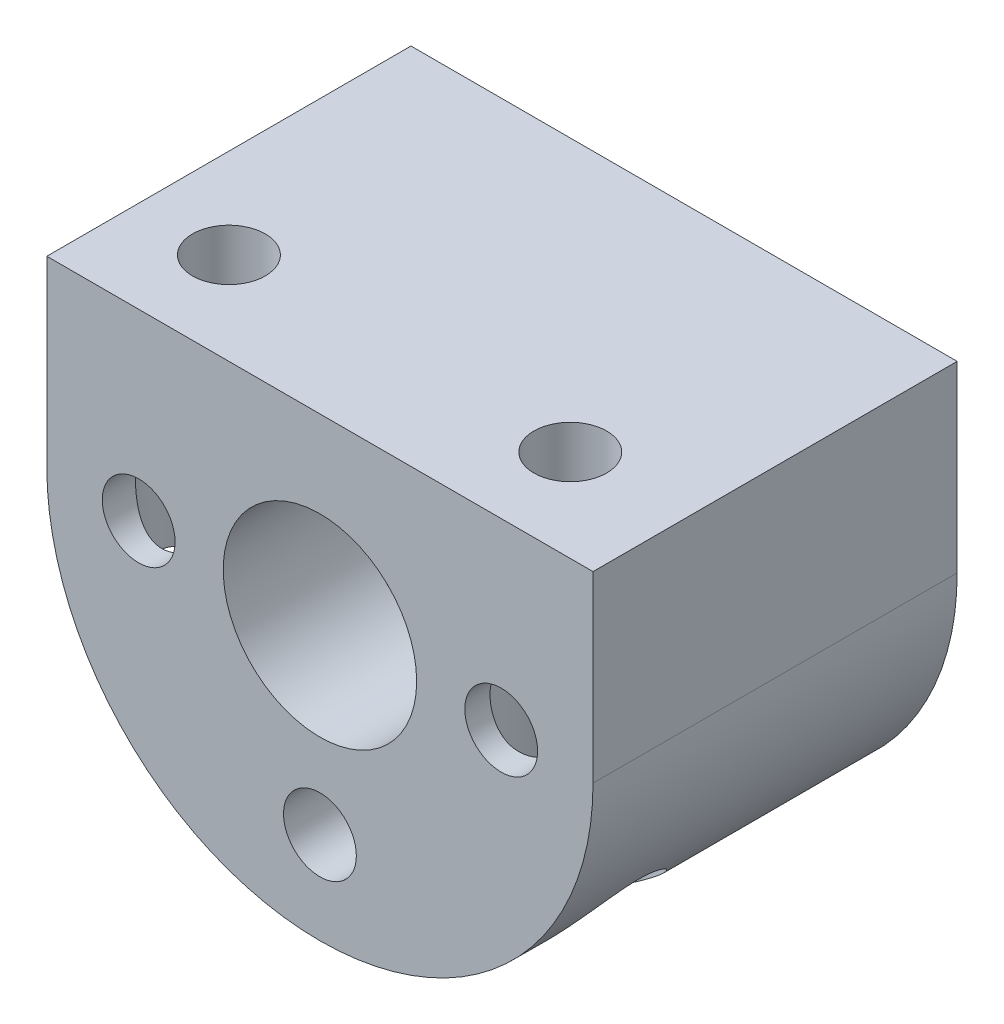
from build123d import *

# Parameters (mm, degrees)
RESSALTO_EXTRUS_O1_DEPTH                = 10
RESSALTO_EXTRUS_O1_DEPTH_BACK           = 6
CORTE_EXTRUS_O1_DEPTH                   = 16
CORTE_EXTRUS_O1_DEPTH_BACK              = 31.8
ESBO_O2_R                               = 5.25
M3_CLEARANCE_HOLE5_D                    = 3.2
CBORE_FOR_M5_HEX_HEAD_BOLT1_D           = 3.2
CBORE_FOR_M5_HEX_HEAD_BOLT1_CBORE_D     = 6
CBORE_FOR_M5_HEX_HEAD_BOLT1_CBORE_DEPTH = 16.5
BOSS_EXTRUDE3_START                     = 1
SKETCH11_W                              = 24
SKETCH11_H                              = 16
SKETCH11_R                              = 1.6
BOSS_EXTRUDE3_DEPTH                     = 1
SKETCH12_R                              = 5.25
SKETCH12_R_2                            = 4.25
BOSS_EXTRUDE5_DEPTH                     = 6
CHAMFER1_SIZE                           = 0.3
CUT_EXTRUDE1_START                      = 43.8
SKETCH13_R                              = 3
CUT_EXTRUDE1_DEPTH                      = 43.8


with BuildPart() as part:
    # Esboço1 → Ressalto-extrusão1 (new, two sides: drawn at the far end of the back side and taken through both)
    with BuildSketch(Plane.XY.offset(-RESSALTO_EXTRUS_O1_DEPTH_BACK)):
        with BuildLine():
            Line((115.646593224, -302.7659332), (115.646593224, -295.7159332))
            Line((115.646593224, -295.7159332), (91.646593224, -295.7159332))
            Line((91.646593224, -295.7159332), (91.646593224, -302.7659332))
            ThreePointArc((91.646593224, -302.7659332), (103.646593224, -314.7659332), (115.646593224, -302.7659332))
        make_face()
    extrude(amount=RESSALTO_EXTRUS_O1_DEPTH + RESSALTO_EXTRUS_O1_DEPTH_BACK)

    # Esboço2 → Corte-extrusão1 (cut, two sides: drawn at the far end of the back side and taken through both)
    with BuildSketch(Plane.XY.offset(10).offset(-CORTE_EXTRUS_O1_DEPTH_BACK)):
        with Locations((103.646593224, -302.7659332)):
            Circle(ESBO_O2_R)
    extrude(amount=CORTE_EXTRUS_O1_DEPTH + CORTE_EXTRUS_O1_DEPTH_BACK, mode=Mode.SUBTRACT)

    # M3 Clearance Hole5 (through all)
    with Locations(Plane.XY.offset(10)):
        with Locations((95.681870132, -302.765933199), (103.646593224, -310.730656291), (111.611316315, -302.765933199)):
            Hole(M3_CLEARANCE_HOLE5_D / 2)

    # CBORE for M5 Hex Head Bolt1 (through all)
    with Locations(Plane(origin=(0, -314.7159332, 0), x_dir=(-1, 0, 0), z_dir=(0, -1, 0))):
        with Locations((-95.596593224, -5.949346208), (-110.596593224, -5.949346208)):
            CounterBoreHole(CBORE_FOR_M5_HEX_HEAD_BOLT1_D / 2, CBORE_FOR_M5_HEX_HEAD_BOLT1_CBORE_D / 2, CBORE_FOR_M5_HEX_HEAD_BOLT1_CBORE_DEPTH)

    # Sketch11 → Boss-Extrude3 (add)
    with BuildSketch(Plane(origin=(0, -295.7159332, 0), x_dir=(1, 0, 0), z_dir=(0, 1, 0)).offset(BOSS_EXTRUDE3_START)):
        with Locations((103.646593224, -2)):
            Rectangle(SKETCH11_W, SKETCH11_H)
        with Locations((95.596593224, -5.949346208)):
            Circle(SKETCH11_R, mode=Mode.SUBTRACT)
        with Locations((110.596593224, -5.949346208)):
            Circle(SKETCH11_R, mode=Mode.SUBTRACT)
    extrude(amount=-BOSS_EXTRUDE3_DEPTH)

    # Sketch12 → Boss-Extrude5 (add)
    with BuildSketch(Plane.XY.offset(10)):
        with Locations((103.646593224, -302.7659332)):
            Circle(SKETCH12_R)
        with Locations((103.646593224, -302.7659332)):
            Circle(SKETCH12_R_2, mode=Mode.SUBTRACT)
    extrude(amount=-BOSS_EXTRUDE5_DEPTH)

    # Chamfer1
    chamfer1_edges = [part.edges().sort_by_distance(p)[0] for p in [
        (98.396593224, -302.7659332, -6),
    ]]
    chamfer(chamfer1_edges, length=CHAMFER1_SIZE)

    # Sketch13 → Cut-Extrude1 (cut)
    with BuildSketch(Plane.XZ.offset(298.2159332).offset(CUT_EXTRUDE1_START)):
        with Locations((95.596593224, 5.949346208)):
            Circle(SKETCH13_R)
        with Locations((110.596593224, 5.949346208)):
            Circle(SKETCH13_R)
    extrude(amount=-CUT_EXTRUDE1_DEPTH, mode=Mode.SUBTRACT)


solid = part.part
